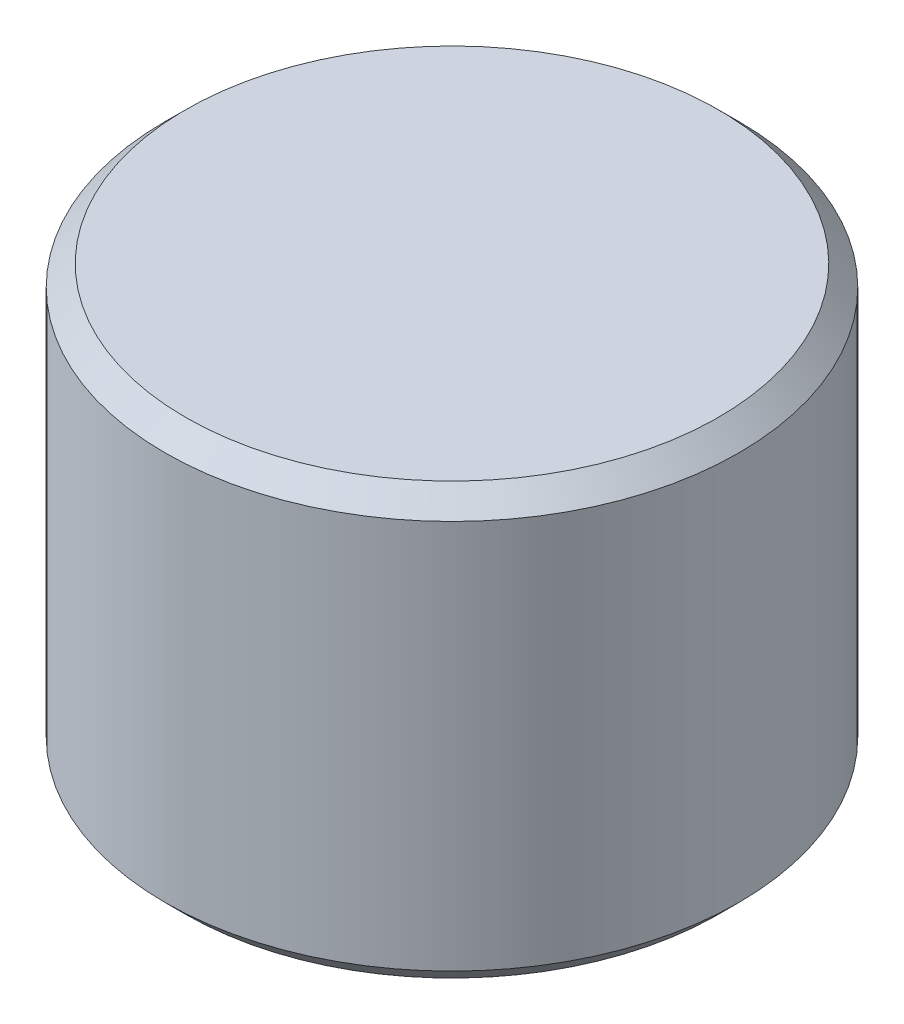
from build123d import *

# Parameters (mm, degrees)
SKETCH1_R           = 4.2
BOSS_EXTRUDE1_DEPTH = 6.3
CHAMFER1_SIZE       = 0.3


with BuildPart() as part:
    # Sketch1 → Boss-Extrude1 (new body)
    with BuildSketch(Plane(origin=(0, 0, 0), x_dir=(1, 0, 0), z_dir=(0, 1, 0))):
        Circle(SKETCH1_R)
    extrude(amount=BOSS_EXTRUDE1_DEPTH)

    # Chamfer1
    chamfer1_edges = [part.edges().sort_by_distance(p)[0] for p in [
        (-4.2, 0, 0),
        (-4.2, 6.3, 0),
    ]]
    chamfer(chamfer1_edges, length=CHAMFER1_SIZE)


solid = part.part
